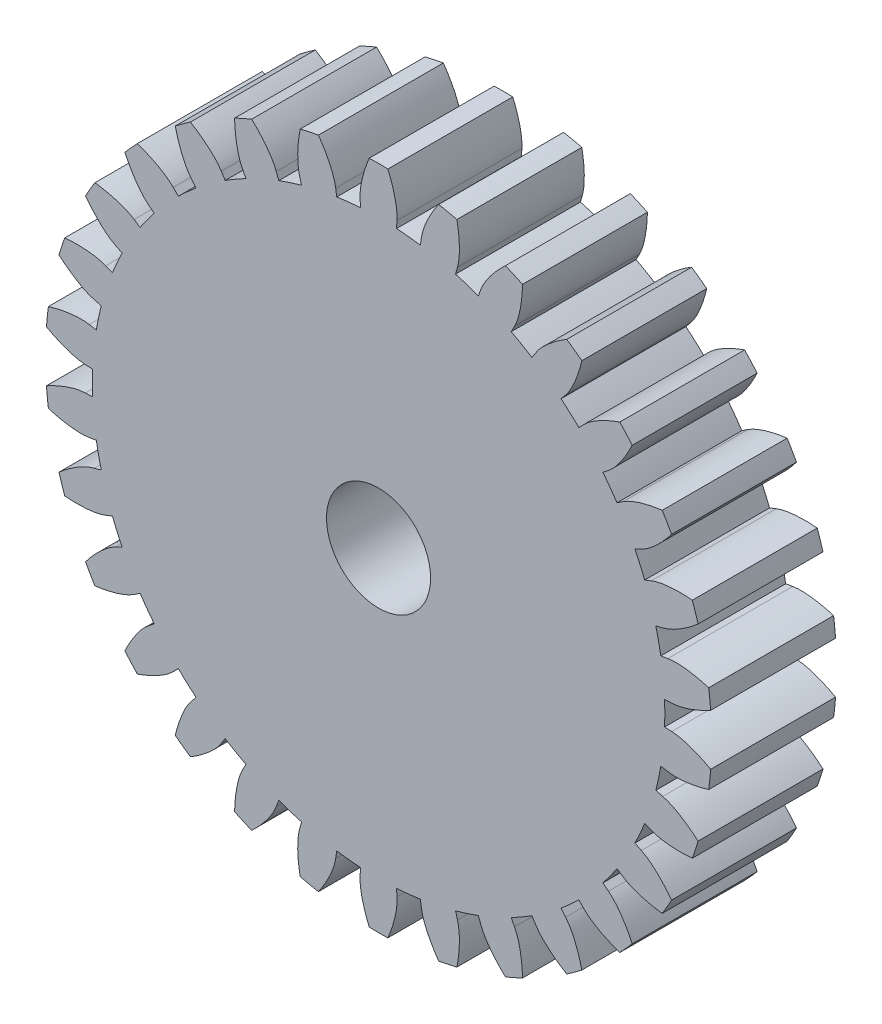
from build123d import *

# Parameters (mm, degrees)
SKETCH_1_R               = 3.2
SKETCH_1_R_2             = 0.5
EXTRUDE_1_DEPTH          = 1.2
CUT_EXTRUDE_1_DEPTH      = 5.681879964
PATTERN_CIRCULAR_1_COUNT = 30
PATTERN_CIRCULAR_1_ANGLE = 348


with BuildPart() as part:
    # 草图1 → 凸台-拉伸1 (new body)
    with BuildSketch(Plane.XY):
        Circle(SKETCH_1_R)
        Circle(SKETCH_1_R_2, mode=Mode.SUBTRACT)
    extrude(amount=EXTRUDE_1_DEPTH)

    # 草图1<3> → 切除-拉伸1 (cut, through all)
    with BuildSketch(Plane.XY):
        with BuildLine():
            Line((2.816610025, 0.117932019), (2.747592634, 0.115042247))
            ThreePointArc((2.747592634, 0.115042247), (2.749398093, 0.057533716), (2.75, 0))
            ThreePointArc((2.75, 0), (2.749398093, -0.057533716), (2.747592634, -0.115042247))
            Line((2.747592634, -0.115042247), (2.816610025, -0.117932019))
            add(Edge.make_bspline(
                [(2.816610025, -0.117932019), (2.838080282, -0.118830983), (2.897809755, -0.125801995), (2.994271355, -0.152747129), (3.086429883, -0.190837012), (3.156104555, -0.226145194), (3.190592662, -0.245190676)],
                knots=[0, 0, 0, 0, 0, 0.005604068, 0.015718248, 0.026019312, 0.026019312, 0.026019312, 0.026019312, 0.026019312], degree=4))
            ThreePointArc((3.190592662, -0.245190676), (3.197647301, -0.122685539), (3.2, 0))
            ThreePointArc((3.2, 0), (3.197647301, 0.122685539), (3.190592662, 0.245190676))
            add(Edge.make_bspline(
                [(2.816610025, 0.117932019), (2.838080282, 0.118830983), (2.897809755, 0.125801995), (2.994271355, 0.152747129), (3.086429883, 0.190837012), (3.156104555, 0.226145194), (3.190592662, 0.245190676)],
                knots=[0, 0, 0, 0, 0, 0.005604068, 0.015718248, 0.026019312, 0.026019312, 0.026019312, 0.026019312, 0.026019312], degree=4))
        make_face()
    cut_extrude_1 = extrude(amount=CUT_EXTRUDE_1_DEPTH, mode=Mode.SUBTRACT)

    # 阵列(圆周)1: 切除-拉伸1 ×30 about axis
    pattern_circular_1_axis = Axis((0, 0, 1.2), (0, 0, 1))
    for i in range(1, PATTERN_CIRCULAR_1_COUNT):
        add(cut_extrude_1.rotate(pattern_circular_1_axis, i * PATTERN_CIRCULAR_1_ANGLE / (PATTERN_CIRCULAR_1_COUNT - 1)), mode=Mode.SUBTRACT)


solid = part.part
